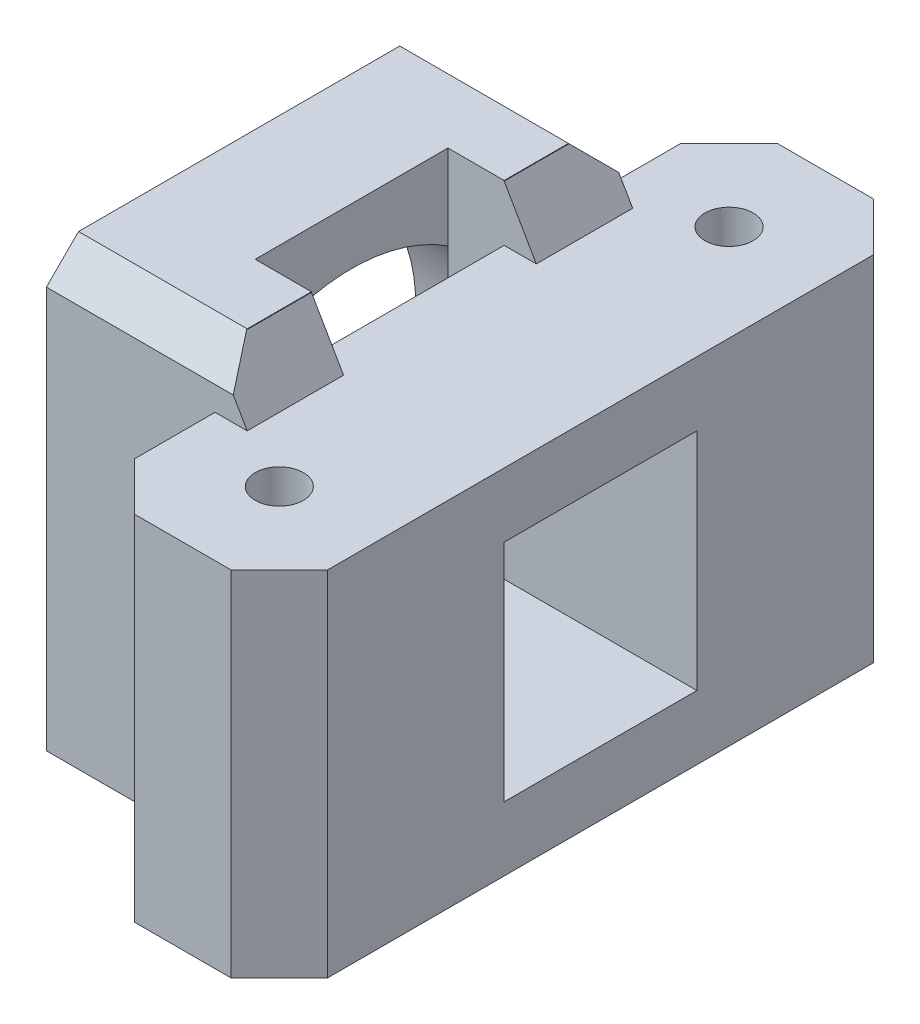
from build123d import *

# Parameters (mm, degrees)
SKETCH1_R           = 1.5
BOSS_EXTRUDE1_DEPTH = 3
BOSS_EXTRUDE2_START = 22.5
SKETCH2_W           = 3.5
SKETCH2_H           = 6
BOSS_EXTRUDE2_DEPTH = 29
SKETCH4_R           = 1.5
BOSS_EXTRUDE5_DEPTH = 1
CHAMFER2_SIZE       = 2
CHAMFER2_SIZE2      = 3.464101615
SKETCH3_W           = 24
SKETCH3_H           = 29
SKETCH3_R           = 11
BOSS_EXTRUDE4_DEPTH = 7
CHAMFER3_SIZE       = 2
SKETCH5_R           = 2
BOSS_EXTRUDE6_DEPTH = 14


# Read off the part's stored shape, not the designer's step: Mirror1
with BuildPart() as part:
    # Sketch1 → Boss-Extrude1 (new body)
    with BuildSketch(Plane(origin=(0, 0, 0), x_dir=(1, 0, 0), z_dir=(0, 1, 0))):
        Polygon((-6, 17), (-3, 20), (3, 20), (6, 17), (6, -17), (3, -20), (-3, -20), (-6, -17), align=None)
        with Locations(Location((0, 14, 0), (0, 0, 270))):
            Circle(SKETCH1_R, mode=Mode.SUBTRACT)
        with Locations(Location((0, -14, 0), (0, 0, 270))):
            Circle(SKETCH1_R, mode=Mode.SUBTRACT)
    extrude(amount=BOSS_EXTRUDE1_DEPTH)

    # Sketch2 → Boss-Extrude2 (add)
    with BuildSketch(Plane(origin=(0, 3, 0), x_dir=(1, 0, 0), z_dir=(0, 1, 0)).offset(BOSS_EXTRUDE2_START)):
        with Locations((-7.75, 9)):
            Rectangle(SKETCH2_W, SKETCH2_H)
        with Locations((-7.75, -9)):
            Rectangle(SKETCH2_W, SKETCH2_H)
    extrude(amount=-BOSS_EXTRUDE2_DEPTH)

    # Sketch4 → Boss-Extrude5 (add)
    with BuildSketch(Plane(origin=(0, 3, 0), x_dir=(1, 0, 0), z_dir=(0, 1, 0))):
        Polygon((-3, 20), (-6, 17), (-6, 12), (-6, 6), (-6, -6), (-6, -12), (-6, -17), (-3, -20), (3, -20), (6, -17), (6, 17), (3, 20), align=None)
        with Locations(Location((0, 14, 0), (0, 0, 270))):
            Circle(SKETCH4_R, mode=Mode.SUBTRACT)
        with Locations(Location((0, -14, 0), (0, 0, 270))):
            Circle(SKETCH4_R, mode=Mode.SUBTRACT)
    extrude(amount=BOSS_EXTRUDE5_DEPTH)

    # Chamfer2
    chamfer2_edges = [part.edges().sort_by_distance(p)[0] for p in [
        (-6, 0, -9),
        (-6, 0, 9),
    ]]
    chamfer2_side = [part.faces().sort_by_distance(p)[0] for p in [
        (0, 0, 0),
    ]]
    chamfer(chamfer2_edges, length=CHAMFER2_SIZE, length2=CHAMFER2_SIZE2, reference=chamfer2_side[0])

    # Sketch3 → Boss-Extrude4 (add)
    with BuildSketch(Plane.ZY.offset(9.5)):
        with Locations((0, 11)):
            Rectangle(SKETCH3_W, SKETCH3_H)
        with Locations(Location((0, 11, 0), (0, 0, 236.944268849))):
            Circle(SKETCH3_R, mode=Mode.SUBTRACT)
    extrude(amount=BOSS_EXTRUDE4_DEPTH)

    # Chamfer3
    chamfer3_edges = [part.edges().sort_by_distance(p)[0] for p in [
        (-11.25, 25.5, -12),
        (-11.25, -3.5, -12),
        (-11.25, -3.5, 12),
        (-11.25, 25.5, 12),
    ]]
    chamfer(chamfer3_edges, length=CHAMFER3_SIZE)

    # Mirror1: part across plane


with BuildPart() as part_1:
    add(part.part)
    add(part.part.mirror(Plane(origin=(0, 11, 0), x_dir=(0, 0, 1), z_dir=(0, -1, 0))))

    # Sketch5 → Boss-Extrude6 (add)
    # profile 1 of 2: a face of its own
    with BuildSketch(Plane(origin=(0, 4, 0), x_dir=(1, 0, 0), z_dir=(0, 1, 0))):
        Polygon((6, -6), (-6, -6), (-6, -17), (-3, -20), (3, -20), (6, -17), align=None)
        with Locations(Location((0, -14, 0), (0, 0, 90))):
            Circle(SKETCH5_R, mode=Mode.SUBTRACT)
    # profile 2 of 2: a face of its own
    with BuildSketch(Plane(origin=(0, 4, 0), x_dir=(1, 0, 0), z_dir=(0, 1, 0))):
        Polygon((-6, 17), (-6, 6), (6, 6), (6, 17), (3, 20), (-3, 20), align=None)
        with Locations(Location((0, 14, 0), (0, 0, 90))):
            Circle(SKETCH5_R, mode=Mode.SUBTRACT)
    extrude(amount=BOSS_EXTRUDE6_DEPTH)


solid = part_1.part
